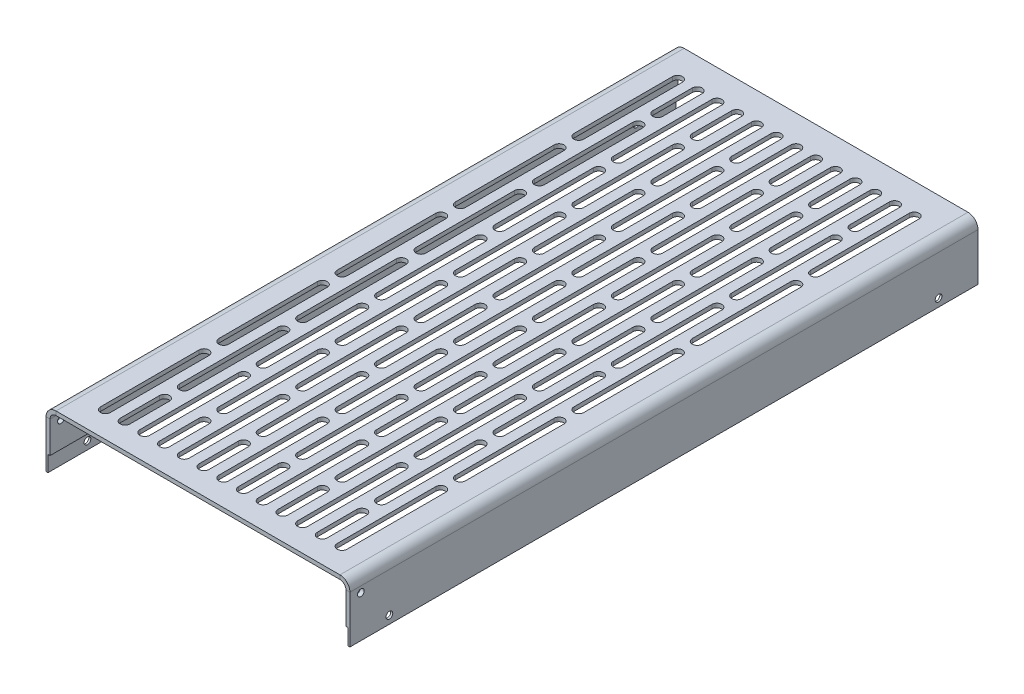
from build123d import *

# Parameters (mm, degrees)
SKETCH1_W                    = 75
SKETCH1_H                    = 318.3528
BASE_FLANGE1_DEPTH           = 2.032
EDGE_FLANGE1_STRIP_W         = 14.224
EDGE_FLANGE1_STRIP_H         = 2.032
EDGE_FLANGE1_STRIP_CUT_DEPTH = 318.3528
EDGE_FLANGE1_DEPTH           = 318.3528
SKETCH9_W                    = 326.228
SKETCH9_H                    = 8
CUT_EXTRUDE1_DEPTH           = 1.016
M3_CLEARANCE_HOLE1_D         = 3.4
M3_CLEARANCE_HOLE3_D         = 3.4
CUT_EXTRUDE2_DEPTH           = 2.032


# Sheet-metal steps are written as plain solids
with BuildPart() as part:
    # Sketch1 → Base-Flange1 (new body)
    with BuildSketch(Plane(origin=(0, 0, 0), x_dir=(1, 0, 0), z_dir=(0, 1, 0))):
        with Locations((37.5, 159.1764)):
            Rectangle(SKETCH1_W, SKETCH1_H)
    extrude(amount=-BASE_FLANGE1_DEPTH)

    # Edge-Flange1 strip (across the edge) → Edge-Flange1 strip cut (cut)
    with BuildSketch(Plane(origin=(75, -2.032, -318.3528), x_dir=(-1, 0, 0), z_dir=(0, 0, 1))):
        with Locations((-4.064, -1.016)):
            Rectangle(EDGE_FLANGE1_STRIP_W, EDGE_FLANGE1_STRIP_H)
    extrude(amount=EDGE_FLANGE1_STRIP_CUT_DEPTH, mode=Mode.SUBTRACT)

    # Edge-Flange1 section (across the edge) → Edge-Flange1 (add)
    with BuildSketch(Plane(origin=(75, -2.032, -318.3528), x_dir=(-1, 0, 0), z_dir=(0, 0, 1))):
        with BuildLine():
            Line((-2.032, 3.048), (-2.032, 27.108))
            Line((-2.032, 27.108), (0, 27.108))
            Line((0, 27.108), (0, 3.048))
            ThreePointArc((0, 3.048), (0.892738531, 0.892738531), (3.048, 0))
            Line((3.048, 0), (3.048, -2.032))
            ThreePointArc((3.048, -2.032), (-0.544102448, -0.544102448), (-2.032, 3.048))
        make_face()
    extrude(amount=EDGE_FLANGE1_DEPTH)

    # Sketch9 → Cut-Extrude1 (cut)
    with BuildSketch(Plane(origin=(75, 0, 0), x_dir=(0, 0, -1), z_dir=(1, 0, 0))):
        with Locations((163.114, -25.14)):
            Rectangle(SKETCH9_W, SKETCH9_H)
    extrude(amount=CUT_EXTRUDE1_DEPTH, mode=Mode.SUBTRACT)

    # M3 Clearance Hole1 (through all)
    with Locations(Plane(origin=(77.032, 0, 0), x_dir=(0, 0, -1), z_dir=(1, 0, 0))):
        with Locations((298.3528, -25.14), (20, -25.14)):
            Hole(M3_CLEARANCE_HOLE1_D / 2)

    # M3 Clearance Hole3 (through all)
    with Locations(Plane.ZY.offset(-75)):
        with Locations((-5.524, -8.08)):
            Hole(M3_CLEARANCE_HOLE3_D / 2)

    # Mirror1: part across plane


with BuildPart() as part_1:
    add(part.part)
    add(part.part.mirror(Plane(origin=(0, -2.032, 0), x_dir=(0, 0, 1), z_dir=(-1, 0, 0))))

    # Sketch29 → Cut-Extrude2 (cut)
    with BuildSketch(Plane(origin=(0, 0, 0), x_dir=(1, 0, 0), z_dir=(0, 1, 0))):
        with BuildLine():
            Line((-57.5, 303.048), (-57.5, 253.048))
            ThreePointArc((-57.5, 253.048), (-60, 250.548), (-62.5, 253.048))
            Line((-62.5, 253.048), (-62.5, 303.048))
            ThreePointArc((-62.5, 303.048), (-60, 305.548), (-57.5, 303.048))
        make_face()
        with BuildLine():
            Line((-57.5, 243.048), (-57.5, 193.048))
            ThreePointArc((-57.5, 193.048), (-60, 190.548), (-62.5, 193.048))
            Line((-62.5, 193.048), (-62.5, 243.048))
            ThreePointArc((-62.5, 243.048), (-60, 245.548), (-57.5, 243.048))
        make_face()
        with BuildLine():
            Line((-57.5, 183.048), (-57.5, 133.048))
            ThreePointArc((-57.5, 133.048), (-60, 130.548), (-62.5, 133.048))
            Line((-62.5, 133.048), (-62.5, 183.048))
            ThreePointArc((-62.5, 183.048), (-60, 185.548), (-57.5, 183.048))
        make_face()
        with BuildLine():
            Line((-57.5, 123.048), (-57.5, 73.048))
            ThreePointArc((-57.5, 73.048), (-60, 70.548), (-62.5, 73.048))
            Line((-62.5, 73.048), (-62.5, 123.048))
            ThreePointArc((-62.5, 123.048), (-60, 125.548), (-57.5, 123.048))
        make_face()
        with BuildLine():
            Line((-57.5, 63.048), (-57.5, 13.048))
            ThreePointArc((-57.5, 13.048), (-60, 10.548), (-62.5, 13.048))
            Line((-62.5, 13.048), (-62.5, 63.048))
            ThreePointArc((-62.5, 63.048), (-60, 65.548), (-57.5, 63.048))
        make_face()
        with BuildLine():
            Line((-47.5, 303.048), (-47.5, 283.048))
            ThreePointArc((-47.5, 283.048), (-50, 280.548), (-52.5, 283.048))
            Line((-52.5, 283.048), (-52.5, 303.048))
            ThreePointArc((-52.5, 303.048), (-50, 305.548), (-47.5, 303.048))
        make_face()
        with BuildLine():
            Line((-47.5, 273.048), (-47.5, 223.048))
            ThreePointArc((-47.5, 223.048), (-50, 220.548), (-52.5, 223.048))
            Line((-52.5, 223.048), (-52.5, 273.048))
            ThreePointArc((-52.5, 273.048), (-50, 275.548), (-47.5, 273.048))
        make_face()
        with BuildLine():
            Line((-47.5, 213.048), (-47.5, 163.048))
            ThreePointArc((-47.5, 163.048), (-50, 160.548), (-52.5, 163.048))
            Line((-52.5, 163.048), (-52.5, 213.048))
            ThreePointArc((-52.5, 213.048), (-50, 215.548), (-47.5, 213.048))
        make_face()
        with BuildLine():
            Line((-47.5, 153.048), (-47.5, 103.048))
            ThreePointArc((-47.5, 103.048), (-50, 100.548), (-52.5, 103.048))
            Line((-52.5, 103.048), (-52.5, 153.048))
            ThreePointArc((-52.5, 153.048), (-50, 155.548), (-47.5, 153.048))
        make_face()
        with BuildLine():
            Line((-47.5, 93.048), (-47.5, 43.048))
            ThreePointArc((-47.5, 43.048), (-50, 40.548), (-52.5, 43.048))
            Line((-52.5, 43.048), (-52.5, 93.048))
            ThreePointArc((-52.5, 93.048), (-50, 95.548), (-47.5, 93.048))
        make_face()
        with BuildLine():
            Line((-52.5, 13.048), (-52.5, 33.048))
            ThreePointArc((-52.5, 33.048), (-50, 35.548), (-47.5, 33.048))
            Line((-47.5, 33.048), (-47.5, 13.048))
            ThreePointArc((-47.5, 13.048), (-50, 10.548), (-52.5, 13.048))
        make_face()
        with BuildLine():
            Line((-37.5, 303.048), (-37.5, 253.048))
            ThreePointArc((-37.5, 253.048), (-40, 250.548), (-42.5, 253.048))
            Line((-42.5, 253.048), (-42.5, 303.048))
            ThreePointArc((-42.5, 303.048), (-40, 305.548), (-37.5, 303.048))
        make_face()
        with BuildLine():
            Line((-37.5, 243.048), (-37.5, 193.048))
            ThreePointArc((-37.5, 193.048), (-40, 190.548), (-42.5, 193.048))
            Line((-42.5, 193.048), (-42.5, 243.048))
            ThreePointArc((-42.5, 243.048), (-40, 245.548), (-37.5, 243.048))
        make_face()
        with BuildLine():
            Line((-37.5, 183.048), (-37.5, 133.048))
            ThreePointArc((-37.5, 133.048), (-40, 130.548), (-42.5, 133.048))
            Line((-42.5, 133.048), (-42.5, 183.048))
            ThreePointArc((-42.5, 183.048), (-40, 185.548), (-37.5, 183.048))
        make_face()
        with BuildLine():
            Line((-37.5, 123.048), (-37.5, 73.048))
            ThreePointArc((-37.5, 73.048), (-40, 70.548), (-42.5, 73.048))
            Line((-42.5, 73.048), (-42.5, 123.048))
            ThreePointArc((-42.5, 123.048), (-40, 125.548), (-37.5, 123.048))
        make_face()
        with BuildLine():
            Line((-37.5, 63.048), (-37.5, 13.048))
            ThreePointArc((-37.5, 13.048), (-40, 10.548), (-42.5, 13.048))
            Line((-42.5, 13.048), (-42.5, 63.048))
            ThreePointArc((-42.5, 63.048), (-40, 65.548), (-37.5, 63.048))
        make_face()
        with BuildLine():
            Line((-27.5, 303.048), (-27.5, 283.048))
            ThreePointArc((-27.5, 283.048), (-30, 280.548), (-32.5, 283.048))
            Line((-32.5, 283.048), (-32.5, 303.048))
            ThreePointArc((-32.5, 303.048), (-30, 305.548), (-27.5, 303.048))
        make_face()
        with BuildLine():
            Line((-27.5, 273.048), (-27.5, 223.048))
            ThreePointArc((-27.5, 223.048), (-30, 220.548), (-32.5, 223.048))
            Line((-32.5, 223.048), (-32.5, 273.048))
            ThreePointArc((-32.5, 273.048), (-30, 275.548), (-27.5, 273.048))
        make_face()
        with BuildLine():
            Line((-27.5, 213.048), (-27.5, 163.048))
            ThreePointArc((-27.5, 163.048), (-30, 160.548), (-32.5, 163.048))
            Line((-32.5, 163.048), (-32.5, 213.048))
            ThreePointArc((-32.5, 213.048), (-30, 215.548), (-27.5, 213.048))
        make_face()
        with BuildLine():
            Line((-27.5, 153.048), (-27.5, 103.048))
            ThreePointArc((-27.5, 103.048), (-30, 100.548), (-32.5, 103.048))
            Line((-32.5, 103.048), (-32.5, 153.048))
            ThreePointArc((-32.5, 153.048), (-30, 155.548), (-27.5, 153.048))
        make_face()
        with BuildLine():
            Line((-27.5, 93.048), (-27.5, 43.048))
            ThreePointArc((-27.5, 43.048), (-30, 40.548), (-32.5, 43.048))
            Line((-32.5, 43.048), (-32.5, 93.048))
            ThreePointArc((-32.5, 93.048), (-30, 95.548), (-27.5, 93.048))
        make_face()
        with BuildLine():
            Line((-32.5, 13.048), (-32.5, 33.048))
            ThreePointArc((-32.5, 33.048), (-30, 35.548), (-27.5, 33.048))
            Line((-27.5, 33.048), (-27.5, 13.048))
            ThreePointArc((-27.5, 13.048), (-30, 10.548), (-32.5, 13.048))
        make_face()
        with BuildLine():
            Line((-17.5, 303.048), (-17.5, 253.048))
            ThreePointArc((-17.5, 253.048), (-20, 250.548), (-22.5, 253.048))
            Line((-22.5, 253.048), (-22.5, 303.048))
            ThreePointArc((-22.5, 303.048), (-20, 305.548), (-17.5, 303.048))
        make_face()
        with BuildLine():
            Line((-17.5, 243.048), (-17.5, 193.048))
            ThreePointArc((-17.5, 193.048), (-20, 190.548), (-22.5, 193.048))
            Line((-22.5, 193.048), (-22.5, 243.048))
            ThreePointArc((-22.5, 243.048), (-20, 245.548), (-17.5, 243.048))
        make_face()
        with BuildLine():
            Line((-17.5, 183.048), (-17.5, 133.048))
            ThreePointArc((-17.5, 133.048), (-20, 130.548), (-22.5, 133.048))
            Line((-22.5, 133.048), (-22.5, 183.048))
            ThreePointArc((-22.5, 183.048), (-20, 185.548), (-17.5, 183.048))
        make_face()
        with BuildLine():
            Line((-17.5, 123.048), (-17.5, 73.048))
            ThreePointArc((-17.5, 73.048), (-20, 70.548), (-22.5, 73.048))
            Line((-22.5, 73.048), (-22.5, 123.048))
            ThreePointArc((-22.5, 123.048), (-20, 125.548), (-17.5, 123.048))
        make_face()
        with BuildLine():
            Line((-17.5, 63.048), (-17.5, 13.048))
            ThreePointArc((-17.5, 13.048), (-20, 10.548), (-22.5, 13.048))
            Line((-22.5, 13.048), (-22.5, 63.048))
            ThreePointArc((-22.5, 63.048), (-20, 65.548), (-17.5, 63.048))
        make_face()
        with BuildLine():
            Line((-7.5, 303.048), (-7.5, 283.048))
            ThreePointArc((-7.5, 283.048), (-10, 280.548), (-12.5, 283.048))
            Line((-12.5, 283.048), (-12.5, 303.048))
            ThreePointArc((-12.5, 303.048), (-10, 305.548), (-7.5, 303.048))
        make_face()
        with BuildLine():
            Line((-7.5, 273.048), (-7.5, 223.048))
            ThreePointArc((-7.5, 223.048), (-10, 220.548), (-12.5, 223.048))
            Line((-12.5, 223.048), (-12.5, 273.048))
            ThreePointArc((-12.5, 273.048), (-10, 275.548), (-7.5, 273.048))
        make_face()
        with BuildLine():
            Line((-7.5, 213.048), (-7.5, 163.048))
            ThreePointArc((-7.5, 163.048), (-10, 160.548), (-12.5, 163.048))
            Line((-12.5, 163.048), (-12.5, 213.048))
            ThreePointArc((-12.5, 213.048), (-10, 215.548), (-7.5, 213.048))
        make_face()
        with BuildLine():
            Line((-7.5, 153.048), (-7.5, 103.048))
            ThreePointArc((-7.5, 103.048), (-10, 100.548), (-12.5, 103.048))
            Line((-12.5, 103.048), (-12.5, 153.048))
            ThreePointArc((-12.5, 153.048), (-10, 155.548), (-7.5, 153.048))
        make_face()
        with BuildLine():
            Line((-7.5, 93.048), (-7.5, 43.048))
            ThreePointArc((-7.5, 43.048), (-10, 40.548), (-12.5, 43.048))
            Line((-12.5, 43.048), (-12.5, 93.048))
            ThreePointArc((-12.5, 93.048), (-10, 95.548), (-7.5, 93.048))
        make_face()
        with BuildLine():
            Line((-12.5, 13.048), (-12.5, 33.048))
            ThreePointArc((-12.5, 33.048), (-10, 35.548), (-7.5, 33.048))
            Line((-7.5, 33.048), (-7.5, 13.048))
            ThreePointArc((-7.5, 13.048), (-10, 10.548), (-12.5, 13.048))
        make_face()
        with BuildLine():
            Line((2.5, 303.048), (2.5, 253.048))
            ThreePointArc((2.5, 253.048), (0, 250.548), (-2.5, 253.048))
            Line((-2.5, 253.048), (-2.5, 303.048))
            ThreePointArc((-2.5, 303.048), (0, 305.548), (2.5, 303.048))
        make_face()
        with BuildLine():
            Line((2.5, 243.048), (2.5, 193.048))
            ThreePointArc((2.5, 193.048), (0, 190.548), (-2.5, 193.048))
            Line((-2.5, 193.048), (-2.5, 243.048))
            ThreePointArc((-2.5, 243.048), (0, 245.548), (2.5, 243.048))
        make_face()
        with BuildLine():
            Line((2.5, 183.048), (2.5, 133.048))
            ThreePointArc((2.5, 133.048), (0, 130.548), (-2.5, 133.048))
            Line((-2.5, 133.048), (-2.5, 183.048))
            ThreePointArc((-2.5, 183.048), (0, 185.548), (2.5, 183.048))
        make_face()
        with BuildLine():
            Line((2.5, 123.048), (2.5, 73.048))
            ThreePointArc((2.5, 73.048), (0, 70.548), (-2.5, 73.048))
            Line((-2.5, 73.048), (-2.5, 123.048))
            ThreePointArc((-2.5, 123.048), (0, 125.548), (2.5, 123.048))
        make_face()
        with BuildLine():
            Line((2.5, 63.048), (2.5, 13.048))
            ThreePointArc((2.5, 13.048), (0, 10.548), (-2.5, 13.048))
            Line((-2.5, 13.048), (-2.5, 63.048))
            ThreePointArc((-2.5, 63.048), (0, 65.548), (2.5, 63.048))
        make_face()
        with BuildLine():
            Line((12.5, 303.048), (12.5, 283.048))
            ThreePointArc((12.5, 283.048), (10, 280.548), (7.5, 283.048))
            Line((7.5, 283.048), (7.5, 303.048))
            ThreePointArc((7.5, 303.048), (10, 305.548), (12.5, 303.048))
        make_face()
        with BuildLine():
            Line((12.5, 273.048), (12.5, 223.048))
            ThreePointArc((12.5, 223.048), (10, 220.548), (7.5, 223.048))
            Line((7.5, 223.048), (7.5, 273.048))
            ThreePointArc((7.5, 273.048), (10, 275.548), (12.5, 273.048))
        make_face()
        with BuildLine():
            Line((12.5, 213.048), (12.5, 163.048))
            ThreePointArc((12.5, 163.048), (10, 160.548), (7.5, 163.048))
            Line((7.5, 163.048), (7.5, 213.048))
            ThreePointArc((7.5, 213.048), (10, 215.548), (12.5, 213.048))
        make_face()
        with BuildLine():
            Line((12.5, 153.048), (12.5, 103.048))
            ThreePointArc((12.5, 103.048), (10, 100.548), (7.5, 103.048))
            Line((7.5, 103.048), (7.5, 153.048))
            ThreePointArc((7.5, 153.048), (10, 155.548), (12.5, 153.048))
        make_face()
        with BuildLine():
            Line((12.5, 93.048), (12.5, 43.048))
            ThreePointArc((12.5, 43.048), (10, 40.548), (7.5, 43.048))
            Line((7.5, 43.048), (7.5, 93.048))
            ThreePointArc((7.5, 93.048), (10, 95.548), (12.5, 93.048))
        make_face()
        with BuildLine():
            Line((7.5, 13.048), (7.5, 33.048))
            ThreePointArc((7.5, 33.048), (10, 35.548), (12.5, 33.048))
            Line((12.5, 33.048), (12.5, 13.048))
            ThreePointArc((12.5, 13.048), (10, 10.548), (7.5, 13.048))
        make_face()
        with BuildLine():
            Line((22.5, 303.048), (22.5, 253.048))
            ThreePointArc((22.5, 253.048), (20, 250.548), (17.5, 253.048))
            Line((17.5, 253.048), (17.5, 303.048))
            ThreePointArc((17.5, 303.048), (20, 305.548), (22.5, 303.048))
        make_face()
        with BuildLine():
            Line((22.5, 243.048), (22.5, 193.048))
            ThreePointArc((22.5, 193.048), (20, 190.548), (17.5, 193.048))
            Line((17.5, 193.048), (17.5, 243.048))
            ThreePointArc((17.5, 243.048), (20, 245.548), (22.5, 243.048))
        make_face()
        with BuildLine():
            Line((22.5, 183.048), (22.5, 133.048))
            ThreePointArc((22.5, 133.048), (20, 130.548), (17.5, 133.048))
            Line((17.5, 133.048), (17.5, 183.048))
            ThreePointArc((17.5, 183.048), (20, 185.548), (22.5, 183.048))
        make_face()
        with BuildLine():
            Line((22.5, 123.048), (22.5, 73.048))
            ThreePointArc((22.5, 73.048), (20, 70.548), (17.5, 73.048))
            Line((17.5, 73.048), (17.5, 123.048))
            ThreePointArc((17.5, 123.048), (20, 125.548), (22.5, 123.048))
        make_face()
        with BuildLine():
            Line((22.5, 63.048), (22.5, 13.048))
            ThreePointArc((22.5, 13.048), (20, 10.548), (17.5, 13.048))
            Line((17.5, 13.048), (17.5, 63.048))
            ThreePointArc((17.5, 63.048), (20, 65.548), (22.5, 63.048))
        make_face()
        with BuildLine():
            Line((32.5, 303.048), (32.5, 283.048))
            ThreePointArc((32.5, 283.048), (30, 280.548), (27.5, 283.048))
            Line((27.5, 283.048), (27.5, 303.048))
            ThreePointArc((27.5, 303.048), (30, 305.548), (32.5, 303.048))
        make_face()
        with BuildLine():
            Line((32.5, 273.048), (32.5, 223.048))
            ThreePointArc((32.5, 223.048), (30, 220.548), (27.5, 223.048))
            Line((27.5, 223.048), (27.5, 273.048))
            ThreePointArc((27.5, 273.048), (30, 275.548), (32.5, 273.048))
        make_face()
        with BuildLine():
            Line((32.5, 213.048), (32.5, 163.048))
            ThreePointArc((32.5, 163.048), (30, 160.548), (27.5, 163.048))
            Line((27.5, 163.048), (27.5, 213.048))
            ThreePointArc((27.5, 213.048), (30, 215.548), (32.5, 213.048))
        make_face()
        with BuildLine():
            Line((32.5, 153.048), (32.5, 103.048))
            ThreePointArc((32.5, 103.048), (30, 100.548), (27.5, 103.048))
            Line((27.5, 103.048), (27.5, 153.048))
            ThreePointArc((27.5, 153.048), (30, 155.548), (32.5, 153.048))
        make_face()
        with BuildLine():
            Line((32.5, 93.048), (32.5, 43.048))
            ThreePointArc((32.5, 43.048), (30, 40.548), (27.5, 43.048))
            Line((27.5, 43.048), (27.5, 93.048))
            ThreePointArc((27.5, 93.048), (30, 95.548), (32.5, 93.048))
        make_face()
        with BuildLine():
            Line((27.5, 13.048), (27.5, 33.048))
            ThreePointArc((27.5, 33.048), (30, 35.548), (32.5, 33.048))
            Line((32.5, 33.048), (32.5, 13.048))
            ThreePointArc((32.5, 13.048), (30, 10.548), (27.5, 13.048))
        make_face()
        with BuildLine():
            Line((42.5, 303.048), (42.5, 253.048))
            ThreePointArc((42.5, 253.048), (40, 250.548), (37.5, 253.048))
            Line((37.5, 253.048), (37.5, 303.048))
            ThreePointArc((37.5, 303.048), (40, 305.548), (42.5, 303.048))
        make_face()
        with BuildLine():
            Line((42.5, 243.048), (42.5, 193.048))
            ThreePointArc((42.5, 193.048), (40, 190.548), (37.5, 193.048))
            Line((37.5, 193.048), (37.5, 243.048))
            ThreePointArc((37.5, 243.048), (40, 245.548), (42.5, 243.048))
        make_face()
        with BuildLine():
            Line((42.5, 183.048), (42.5, 133.048))
            ThreePointArc((42.5, 133.048), (40, 130.548), (37.5, 133.048))
            Line((37.5, 133.048), (37.5, 183.048))
            ThreePointArc((37.5, 183.048), (40, 185.548), (42.5, 183.048))
        make_face()
        with BuildLine():
            Line((42.5, 123.048), (42.5, 73.048))
            ThreePointArc((42.5, 73.048), (40, 70.548), (37.5, 73.048))
            Line((37.5, 73.048), (37.5, 123.048))
            ThreePointArc((37.5, 123.048), (40, 125.548), (42.5, 123.048))
        make_face()
        with BuildLine():
            Line((42.5, 63.048), (42.5, 13.048))
            ThreePointArc((42.5, 13.048), (40, 10.548), (37.5, 13.048))
            Line((37.5, 13.048), (37.5, 63.048))
            ThreePointArc((37.5, 63.048), (40, 65.548), (42.5, 63.048))
        make_face()
        with BuildLine():
            Line((52.5, 303.048), (52.5, 283.048))
            ThreePointArc((52.5, 283.048), (50, 280.548), (47.5, 283.048))
            Line((47.5, 283.048), (47.5, 303.048))
            ThreePointArc((47.5, 303.048), (50, 305.548), (52.5, 303.048))
        make_face()
        with BuildLine():
            Line((52.5, 273.048), (52.5, 223.048))
            ThreePointArc((52.5, 223.048), (50, 220.548), (47.5, 223.048))
            Line((47.5, 223.048), (47.5, 273.048))
            ThreePointArc((47.5, 273.048), (50, 275.548), (52.5, 273.048))
        make_face()
        with BuildLine():
            Line((52.5, 213.048), (52.5, 163.048))
            ThreePointArc((52.5, 163.048), (50, 160.548), (47.5, 163.048))
            Line((47.5, 163.048), (47.5, 213.048))
            ThreePointArc((47.5, 213.048), (50, 215.548), (52.5, 213.048))
        make_face()
        with BuildLine():
            Line((52.5, 153.048), (52.5, 103.048))
            ThreePointArc((52.5, 103.048), (50, 100.548), (47.5, 103.048))
            Line((47.5, 103.048), (47.5, 153.048))
            ThreePointArc((47.5, 153.048), (50, 155.548), (52.5, 153.048))
        make_face()
        with BuildLine():
            Line((52.5, 93.048), (52.5, 43.048))
            ThreePointArc((52.5, 43.048), (50, 40.548), (47.5, 43.048))
            Line((47.5, 43.048), (47.5, 93.048))
            ThreePointArc((47.5, 93.048), (50, 95.548), (52.5, 93.048))
        make_face()
        with BuildLine():
            Line((47.5, 13.048), (47.5, 33.048))
            ThreePointArc((47.5, 33.048), (50, 35.548), (52.5, 33.048))
            Line((52.5, 33.048), (52.5, 13.048))
            ThreePointArc((52.5, 13.048), (50, 10.548), (47.5, 13.048))
        make_face()
        with BuildLine():
            Line((62.5, 303.048), (62.5, 253.048))
            ThreePointArc((62.5, 253.048), (60, 250.548), (57.5, 253.048))
            Line((57.5, 253.048), (57.5, 303.048))
            ThreePointArc((57.5, 303.048), (60, 305.548), (62.5, 303.048))
        make_face()
        with BuildLine():
            Line((62.5, 243.048), (62.5, 193.048))
            ThreePointArc((62.5, 193.048), (60, 190.548), (57.5, 193.048))
            Line((57.5, 193.048), (57.5, 243.048))
            ThreePointArc((57.5, 243.048), (60, 245.548), (62.5, 243.048))
        make_face()
        with BuildLine():
            Line((62.5, 183.048), (62.5, 133.048))
            ThreePointArc((62.5, 133.048), (60, 130.548), (57.5, 133.048))
            Line((57.5, 133.048), (57.5, 183.048))
            ThreePointArc((57.5, 183.048), (60, 185.548), (62.5, 183.048))
        make_face()
        with BuildLine():
            Line((62.5, 123.048), (62.5, 73.048))
            ThreePointArc((62.5, 73.048), (60, 70.548), (57.5, 73.048))
            Line((57.5, 73.048), (57.5, 123.048))
            ThreePointArc((57.5, 123.048), (60, 125.548), (62.5, 123.048))
        make_face()
        with BuildLine():
            Line((62.5, 63.048), (62.5, 13.048))
            ThreePointArc((62.5, 13.048), (60, 10.548), (57.5, 13.048))
            Line((57.5, 13.048), (57.5, 63.048))
            ThreePointArc((57.5, 63.048), (60, 65.548), (62.5, 63.048))
        make_face()
    extrude(amount=-CUT_EXTRUDE2_DEPTH, mode=Mode.SUBTRACT)


solid = part_1.part
